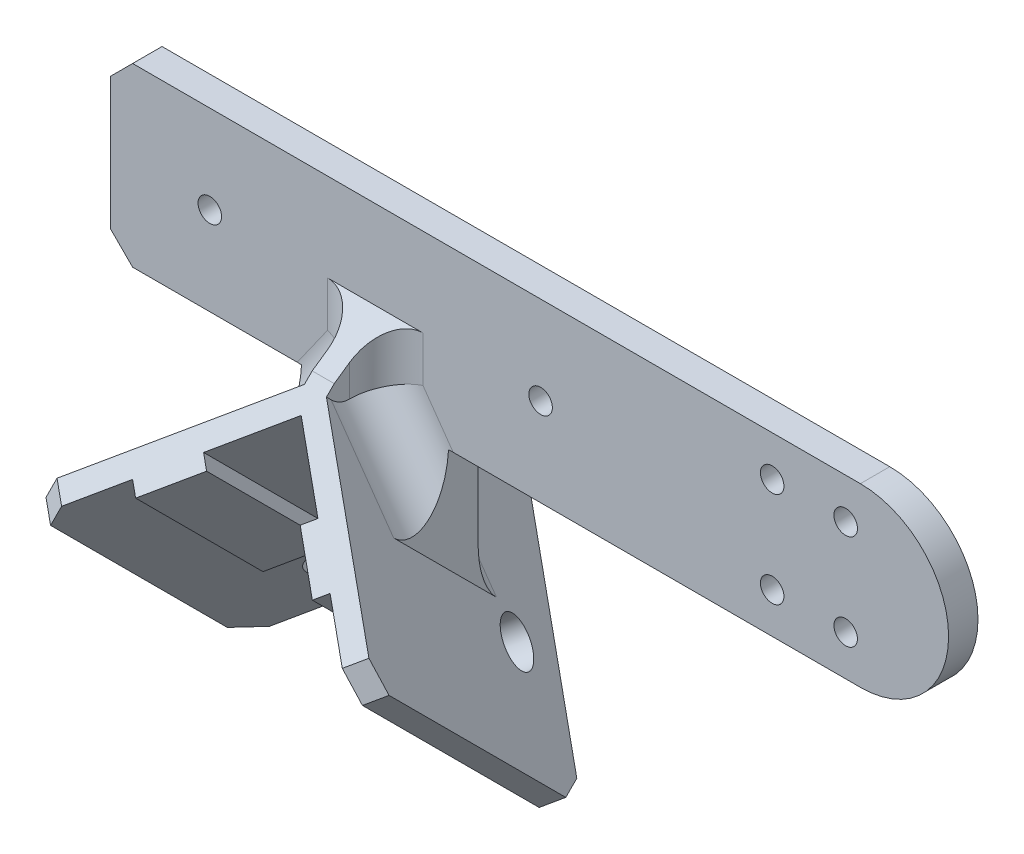
from build123d import *

# Parameters (mm, degrees)
CROQUIS1_R                   = 1.6
SALIENTE_EXTRUIR1_DEPTH      = 4
CROQUIS3_R                   = 1.6
SALIENTE_EXTRUIR3_DEPTH      = 4
SALIENTE_EXTRUIR4_DEPTH      = 10
SALIENTE_EXTRUIR4_DEPTH_BACK = 30
CORTAR_EXTRUIR8_REACH        = 102.817
CROQUIS13_R                  = 3.1
CORTAR_EXTRUIR9_DEPTH        = 2
CORTAR_EXTRUIR10_REACH       = 92.973
CROQUIS15_R                  = 3.1
CORTAR_EXTRUIR11_DEPTH       = 2
CORTAR_EXTRUIR12_DEPTH       = 99.523002923
SALIENTE_EXTRUIR5_DEPTH      = 1.5
REDONDEO1_R                  = 5
CHAFL_N1_SIZE                = 3
REDONDEO2_R                  = 5


with BuildPart() as part:
    # Croquis1 → Saliente-Extruir1 (new body)
    with BuildSketch(Plane.XY):
        Polygon((10, -12), (36, -12), (36, 12), (-36, 12), (-36, -12), (-10, -12), (-10, -32), (10, -32), align=None)
        with Locations((-22.5, 0)):
            Circle(CROQUIS1_R, mode=Mode.SUBTRACT)
        with Locations(Location((22.5, 0, 0), (0, 0, 180))):
            Circle(CROQUIS1_R, mode=Mode.SUBTRACT)
    extrude(amount=SALIENTE_EXTRUIR1_DEPTH)

    # Croquis3 → Saliente-Extruir3 (add)
    with BuildSketch(Plane(origin=(0, 0, 0), x_dir=(-1, 0, 0), z_dir=(0, 0, -1))):
        with BuildLine():
            Line((-66, 12), (-36, 12))
            Line((-36, 12), (-36, -12))
            Line((-36, -12), (-66, -12))
            ThreePointArc((-66, -12), (-78, 0), (-66, 12))
        make_face()
        with Locations((-54, 6.5)):
            Circle(CROQUIS3_R, mode=Mode.SUBTRACT)
        with Locations((-64, 6.5)):
            Circle(CROQUIS3_R, mode=Mode.SUBTRACT)
        with Locations(Location((-54, -6.5, 0), (0, 0, 180))):
            Circle(CROQUIS3_R, mode=Mode.SUBTRACT)
        with Locations(Location((-64, -6.5, 0), (0, 0, 180))):
            Circle(CROQUIS3_R, mode=Mode.SUBTRACT)
    extrude(amount=-SALIENTE_EXTRUIR3_DEPTH)

    # Croquis5 → Saliente-Extruir4 (add, two sides: drawn at the far end of the back side and taken through both)
    with BuildSketch(Plane(origin=(0, -4.201010127, -3.798989873), x_dir=(1, 0, 0), z_dir=(0, 0.7071067811865438, 0.7071067811865512)).offset(-SALIENTE_EXTRUIR4_DEPTH_BACK)):
        Polygon((-13.435028843, -28.707106781), (-21.213203436, -36.485281374), (-23.334523779, -34.363961031), (0, -11.029437252), (23.334523779, -34.363961031), (21.213203436, -36.485281374), (13.435028843, -28.707106781), (12.02081528, -30.121320344), (6.363961031, -24.464466094), (7.778174593, -23.050252532), (0, -15.272077939), (-7.778174593, -23.050252532), (-6.363961031, -24.464466094), (-12.02081528, -30.121320344), align=None)
    extrude(amount=SALIENTE_EXTRUIR4_DEPTH + SALIENTE_EXTRUIR4_DEPTH_BACK)

    # Croquis13 → Cortar-Extruir8 (cut, up to next)
    with BuildSketch(Plane(origin=(-9.192388155, -6.5, 6.5), x_dir=(0.40824829046385985, 0.2886751345948103, 0.866025403784441), z_dir=(-0.7071067811865496, -0.5000000000000013, 0.4999999999999959)), mode=Mode.PRIVATE) as cortar_extruir8_sk1:
        with Locations(Location((-7.570619935, -37.19660335, 0), (0, 0, 270))):
            Circle(CROQUIS13_R)
    cortar_extruir8_tool1 = extrude(cortar_extruir8_sk1.sketch, amount=-CORTAR_EXTRUIR8_REACH, mode=Mode.PRIVATE) & part.part
    add(cortar_extruir8_tool1.solids().sort_by_distance((9.192388, -39.056349, -0.056349))[0], mode=Mode.SUBTRACT)

    # Croquis14 → Cortar-Extruir9 (cut)
    with BuildSketch(Plane(origin=(-9.192388155, -6.5, 6.5), x_dir=(0.40824829046385985, 0.2886751345948103, 0.866025403784441), z_dir=(-0.7071067811865496, -0.5000000000000013, 0.4999999999999959))):
        Polygon((-13.554255626, -36.528693238), (-8.935453472, -43.060665885), (-1.586984244, -37.864513462), (-6.205786398, -31.332540815), align=None)
    extrude(amount=-CORTAR_EXTRUIR9_DEPTH, mode=Mode.SUBTRACT)

    # Croquis15 → Cortar-Extruir10 (cut, up to next)
    with BuildSketch(Plane(origin=(6.12825877, -4.333333333, 13), x_dir=(0.6666666666666553, 0.23570226039552375, -0.7071067811865557), z_dir=(0.7071067811865587, -0.49999999999999484, 0.4999999999999895)), mode=Mode.PRIVATE) as cortar_extruir10_sk1:
        with Locations(Location((-9.165824894, -39.075132248, 0), (0, 0, 54.735610317))):
            Circle(CROQUIS15_R)
    cortar_extruir10_tool1 = extrude(cortar_extruir10_sk1.sketch, amount=-CORTAR_EXTRUIR10_REACH, mode=Mode.PRIVATE) & part.part
    add(cortar_extruir10_tool1.solids().sort_by_distance((-9.192388, -39.056349, -0.056349))[0], mode=Mode.SUBTRACT)

    # Croquis17 → Cortar-Extruir11 (cut)
    with BuildSketch(Plane(origin=(6.12825877, -4.333333333, 13), x_dir=(0.6666666666666595, 0.2357022603955385, -0.7071067811865467), z_dir=(0.7071067811865586, -0.4999999999999948, 0.49999999999998956))):
        Polygon((-11.437061061, -44.651106269), (-3.894588728, -41.984439602), (-6.894588728, -33.499158228), (-14.437061061, -36.165824894), align=None)
    extrude(amount=-CORTAR_EXTRUIR11_DEPTH, mode=Mode.SUBTRACT)

    # Croquis18 → Cortar-Extruir12 (cut, through all)
    with BuildSketch(Plane(origin=(0, 3.071067812, 3.071067812), x_dir=(1, 0, 0), z_dir=(0, 0.7071067811865438, 0.7071067811865513))):
        Polygon((-7.071067812, -25.455844123), (-6.363961031, -24.748737342), (-7.778174593, -23.334523779), (0, -15.556349186), (7.778174593, -23.334523779), (6.363961031, -24.748737342), (7.071067812, -25.455844123), align=None)
    extrude(amount=-CORTAR_EXTRUIR12_DEPTH, mode=Mode.SUBTRACT)

    # Croquis19 → Saliente-Extruir5 (add, symmetric)
    with BuildSketch(Plane(origin=(0, 0, 0), x_dir=(0, 0, -1), z_dir=(1, 0, 0))):
        Polygon((-11.071067812, -4.928932188), (-12.636805519, -6.494669895), (-4, -15.642184556), (-4, 0), align=None)
    extrude(amount=SALIENTE_EXTRUIR5_DEPTH, both=True)

    # Redondeo1
    # the kernel refuses this fillet: 5 mm, written as the material it adds along each edge
    with BuildSketch(Plane(origin=(1.5, -26.621320344, 4), x_dir=(0, 0, 1), z_dir=(0, 1, 0))) as redondeo1_piece_1_section:
        with BuildLine():
            CenterArc((REDONDEO1_R, REDONDEO1_R), REDONDEO1_R, 180, 90)
            Line((0, REDONDEO1_R), (0, 0))
            Line((0, 0), (REDONDEO1_R, 0))
        make_face()
    redondeo1_piece_1 = extrude(amount=39.121320344, mode=Mode.PRIVATE)
    redondeo1_piece_1 = split(redondeo1_piece_1, bisect_by=Plane(origin=(2.770443411, -3.003654562, 8.309056055), z_dir=(0, -0.8203648475065346, -0.5718404646189182)), keep=Keep.TOP, mode=Mode.PRIVATE)
    redondeo1_piece_1 = split(redondeo1_piece_1, bisect_by=Plane(origin=(0.243258748, -9.601208631, 6.742811189), z_dir=(0.7071067811865499, 0.5000000000000011, -0.4999999999999958)), keep=Keep.TOP, mode=Mode.PRIVATE)
    add(redondeo1_piece_1)
    with BuildSketch(Plane(origin=(22.5, -43.819805153, 4), x_dir=(0.40824829046386, 0.28867513459481037, 0.8660254037844409), z_dir=(-0.5773502691896252, 0.8164965809277265, 0))) as redondeo1_piece_2_section:
        with BuildLine():
            CenterArc((REDONDEO1_R * 1.73205080757, REDONDEO1_R), REDONDEO1_R, 150, 120)
            Line((REDONDEO1_R * 0.866025403784, REDONDEO1_R * 1.5), (0, 0))
            Line((0, 0), (REDONDEO1_R * 1.73205080757, 0))
        make_face()
    redondeo1_piece_2 = extrude(amount=58.023702054, mode=Mode.PRIVATE)
    redondeo1_piece_2 = split(redondeo1_piece_2, bisect_by=Plane(origin=(10.121286225, -12, 4.004914318), z_dir=(0, 1, 0)), keep=Keep.TOP, mode=Mode.PRIVATE)
    redondeo1_piece_2 = split(redondeo1_piece_2, bisect_by=Plane(origin=(1.5, -11.828475377, 4.004914318), z_dir=(1, 0, 0)), keep=Keep.TOP, mode=Mode.PRIVATE)
    redondeo1_piece_2 = split(redondeo1_piece_2, bisect_by=Plane(origin=(10.121286225, -3.870234786, 9.552255859), z_dir=(0, -0.8203648475065346, -0.5718404646189182)), keep=Keep.TOP, mode=Mode.PRIVATE)
    add(redondeo1_piece_2)
    with BuildSketch(Plane(origin=(22.5, -43.819805153, 4), x_dir=(0.40824829046386, 0.28867513459481037, 0.8660254037844409), z_dir=(-0.5773502691896252, 0.8164965809277265, 0))) as redondeo1_piece_3_section:
        with BuildLine():
            CenterArc((REDONDEO1_R * 1.73205080757, REDONDEO1_R), REDONDEO1_R, 150, 120)
            Line((REDONDEO1_R * 0.866025403784, REDONDEO1_R * 1.5), (0, 0))
            Line((0, 0), (REDONDEO1_R * 1.73205080757, 0))
        make_face()
    redondeo1_piece_3 = extrude(amount=58.023702054, mode=Mode.PRIVATE)
    redondeo1_piece_3 = split(redondeo1_piece_3, bisect_by=Plane(origin=(1.5, -16.67856606, 5.887042233), z_dir=(1, 0, 0)), keep=Keep.TOP, mode=Mode.PRIVATE)
    redondeo1_piece_3 = split(redondeo1_piece_3, bisect_by=Plane(origin=(6.744949826, -6.339161533, 13.094189037), z_dir=(0, -0.8203648475065346, -0.5718404646189182)), keep=Keep.TOP, mode=Mode.PRIVATE)
    redondeo1_piece_3 = split(redondeo1_piece_3, bisect_by=Plane(origin=(10, -16.67856606, 5.887042233), z_dir=(-1, 0, 0)), keep=Keep.TOP, mode=Mode.PRIVATE)
    add(redondeo1_piece_3)
    with BuildSketch(Plane(origin=(11, 3.556349186, 4), x_dir=(-0.40824829046385974, 0.2886751345948099, 0.8660254037844413), z_dir=(-0.577350269189625, -0.8164965809277267, 0))) as redondeo1_piece_4_section:
        with BuildLine():
            CenterArc((REDONDEO1_R * 1.73205080757, REDONDEO1_R), REDONDEO1_R, 150, 120)
            Line((REDONDEO1_R * 0.866025403784, REDONDEO1_R * 1.5), (0, 0))
            Line((0, 0), (REDONDEO1_R * 1.73205080757, 0))
        make_face()
    redondeo1_piece_4 = extrude(amount=58.023702054, mode=Mode.PRIVATE)
    redondeo1_piece_4 = split(redondeo1_piece_4, bisect_by=Plane(origin=(-10, -9.487690483, 5.71835717), z_dir=(1, 0, 0)), keep=Keep.TOP, mode=Mode.PRIVATE)
    redondeo1_piece_4 = split(redondeo1_piece_4, bisect_by=Plane(origin=(-3.276486879, -3.908601143, 9.607296403), z_dir=(0, -0.8203648475065346, -0.5718404646189182)), keep=Keep.TOP, mode=Mode.PRIVATE)
    redondeo1_piece_4 = split(redondeo1_piece_4, bisect_by=Plane(origin=(-1.5, -9.487690483, 5.71835717), z_dir=(-1, 0, 0)), keep=Keep.TOP, mode=Mode.PRIVATE)
    add(redondeo1_piece_4)
    with BuildSketch(Plane(origin=(11, 3.556349186, 4), x_dir=(-0.40824829046385974, 0.2886751345948099, 0.8660254037844413), z_dir=(-0.577350269189625, -0.8164965809277267, 0))) as redondeo1_piece_5_section:
        with BuildLine():
            CenterArc((REDONDEO1_R * 1.73205080757, REDONDEO1_R), REDONDEO1_R, 150, 120)
            Line((REDONDEO1_R * 0.866025403784, REDONDEO1_R * 1.5), (0, 0))
            Line((0, 0), (REDONDEO1_R * 1.73205080757, 0))
        make_face()
    redondeo1_piece_5 = extrude(amount=58.023702054, mode=Mode.PRIVATE)
    redondeo1_piece_5 = split(redondeo1_piece_5, bisect_by=Plane(origin=(-10.121286225, -12, 4.004914318), z_dir=(0, 1, 0)), keep=Keep.TOP, mode=Mode.PRIVATE)
    redondeo1_piece_5 = split(redondeo1_piece_5, bisect_by=Plane(origin=(-10.121286225, -3.870234786, 9.552255859), z_dir=(0, -0.8203648475065346, -0.5718404646189182)), keep=Keep.TOP, mode=Mode.PRIVATE)
    redondeo1_piece_5 = split(redondeo1_piece_5, bisect_by=Plane(origin=(-1.5, -11.828475377, 4.004914318), z_dir=(-1, 0, 0)), keep=Keep.TOP, mode=Mode.PRIVATE)
    add(redondeo1_piece_5)
    with BuildSketch(Plane(origin=(-1.5, -26.621320344, 4), x_dir=(0, 0, 1), z_dir=(0, 1, 0))) as redondeo1_piece_6_section:
        with BuildLine():
            CenterArc((REDONDEO1_R, -REDONDEO1_R), REDONDEO1_R, 90, 90)
            Line((0, -REDONDEO1_R), (0, 0))
            Line((0, 0), (REDONDEO1_R, 0))
        make_face()
    redondeo1_piece_6 = extrude(amount=39.121320344, mode=Mode.PRIVATE)
    redondeo1_piece_6 = split(redondeo1_piece_6, bisect_by=Plane(origin=(1.878061596, -11.101208631, 8.242811189), z_dir=(-0.7071067811865511, 0.5000000000000001, -0.4999999999999948)), keep=Keep.TOP, mode=Mode.PRIVATE)
    redondeo1_piece_6 = split(redondeo1_piece_6, bisect_by=Plane(origin=(-2.770443411, -3.003654562, 8.309056055), z_dir=(0, -0.8203648475065346, -0.5718404646189182)), keep=Keep.TOP, mode=Mode.PRIVATE)
    add(redondeo1_piece_6)

    # Chaflán1
    # the kernel refuses this chamfer: 3 mm, written as the material it takes off along each edge
    with BuildSketch(Plane(origin=(0.908597591, -30.016844189, -2.731893153), x_dir=(-0.01944252080601415, 0.6930914977653764, 0.7205873743759705), z_dir=(0.7071067811865457, -0.5000000000000041, 0.49999999999999856))) as chafl_n1_piece_1_section:
        Polygon((CHAFL_N1_SIZE * 0.999621916911, -CHAFL_N1_SIZE * 0.0274958766106), (-CHAFL_N1_SIZE * 0.0274958766106, -CHAFL_N1_SIZE * 0.999621916911), (0, 0), align=None)
    chafl_n1_piece_1 = extrude(amount=23.430097928, mode=Mode.PRIVATE)
    chafl_n1_piece_1 = split(chafl_n1_piece_1, bisect_by=Plane(origin=(10.606601718, -34.102143715, 2.897856285), z_dir=(-0.7071067811865376, -0.5000000000000097, 0.5000000000000046)), keep=Keep.TOP, mode=Mode.PRIVATE)
    add(chafl_n1_piece_1, mode=Mode.SUBTRACT)
    with BuildSketch(Plane(origin=(-36, -12, -7.715048964), x_dir=(0.9996219169112968, -0.02749587661058619, 0), z_dir=(0, 0, 1)), Plane(origin=(-36, 12, -7.715048964), x_dir=(-0.02749587661058678, -0.9996219169112968, 0), z_dir=(0, 0, 1))) as chafl_n1_piece_2:
        Polygon((CHAFL_N1_SIZE * 0.999621916911, CHAFL_N1_SIZE * 0.0274958766106), (-CHAFL_N1_SIZE * 0.0274958766106, CHAFL_N1_SIZE * 0.999621916911), (0, 0), align=None)
    extrude(amount=19.430097928, mode=Mode.SUBTRACT)
    with BuildSketch(Plane(origin=(-17.47617872, -41.731893153, 8.983155811), x_dir=(-0.7068394360706848, 0.48036843764962867, -0.5192534792616522), z_dir=(0.7071067811865362, 0.5000000000000103, -0.5000000000000059))) as chafl_n1_piece_3_section:
        Polygon((CHAFL_N1_SIZE * 0.999621916911, CHAFL_N1_SIZE * 0.0274958766106), (-CHAFL_N1_SIZE * 0.0274958766106, CHAFL_N1_SIZE * 0.999621916911), (0, 0), align=None)
    chafl_n1_piece_3 = extrude(amount=23.430097928, mode=Mode.PRIVATE)
    chafl_n1_piece_3 = split(chafl_n1_piece_3, bisect_by=Plane(origin=(-10.606601718, -34.102143715, 2.897856285), z_dir=(0.7071067811865511, -0.5000000000000001, 0.4999999999999948)), keep=Keep.TOP, mode=Mode.PRIVATE)
    add(chafl_n1_piece_3, mode=Mode.SUBTRACT)
    with BuildSketch(Plane(origin=(-15.757839996, -55.070727918, 4.644321046), x_dir=(-0.01944252080601493, 0.693091497765376, 0.7205873743759708), z_dir=(-0.7071067811865476, 0.5000000000000027, -0.4999999999999974))) as chafl_n1_piece_4:
        Polygon((CHAFL_N1_SIZE * 0.999621916911, CHAFL_N1_SIZE * 0.0274958766106), (-CHAFL_N1_SIZE * 0.0274958766106, CHAFL_N1_SIZE * 0.999621916911), (0, 0), align=None)
    extrude(amount=18.430097928, mode=Mode.SUBTRACT)
    with BuildSketch(Plane(origin=(28.789887219, -45.855678954, -4.570727918), x_dir=(-0.7068394360706699, 0.48036843764963866, -0.5192534792616634), z_dir=(-0.7071067811865511, -0.5000000000000001, 0.4999999999999949)), Plane(origin=(-15.757839996, -26.78645667, 32.928592294), x_dir=(-0.019442520806013802, -0.7205873743759628, -0.6930914977653844), z_dir=(-0.7071067811865476, 0.5000000000000027, -0.4999999999999974)), Plane(origin=(28.789887219, -17.571407706, 23.71354333), x_dir=(0.019442520806014007, -0.7205873743759631, -0.693091497765384), z_dir=(-0.7071067811865511, -0.5000000000000001, 0.4999999999999949))) as chafl_n1_piece_5:
        Polygon((CHAFL_N1_SIZE * 0.999621916911, -CHAFL_N1_SIZE * 0.0274958766106), (-CHAFL_N1_SIZE * 0.0274958766106, -CHAFL_N1_SIZE * 0.999621916911), (0, 0), align=None)
    extrude(amount=18.430097928, mode=Mode.SUBTRACT)

    # Redondeo2
    redondeo2_edges = [part.edges().sort_by_distance(p)[0] for p in [
        (-5, -23.071067812, 0),
        (5, -23.071067812, 0),
    ]]
    fillet(redondeo2_edges, radius=REDONDEO2_R)


solid = part.part
